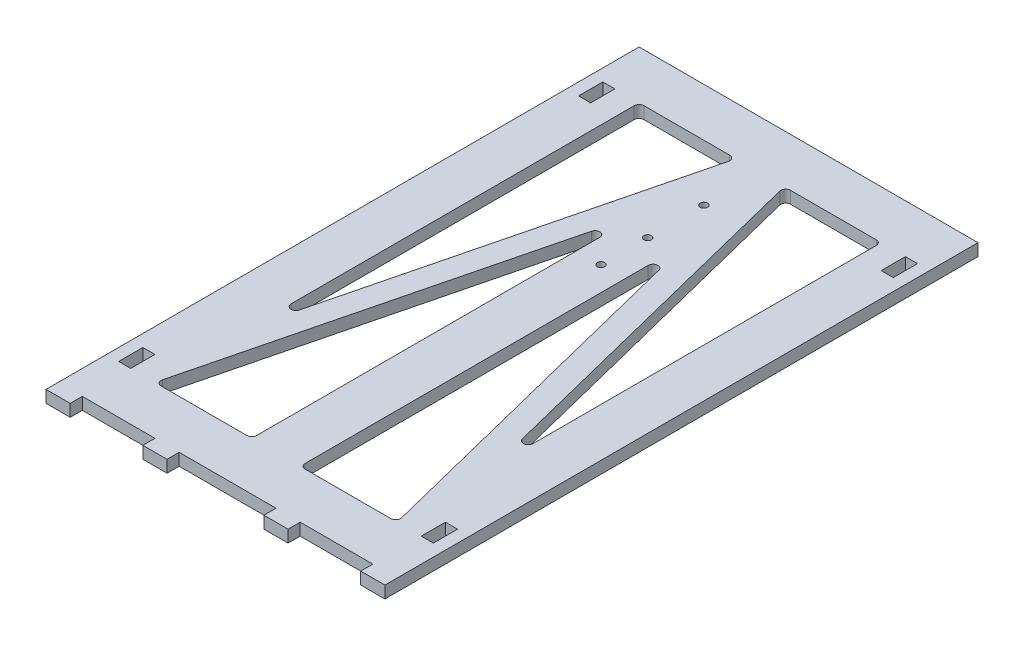
from build123d import *

# Parameters (mm, degrees)
SKETCH1_W         = 6.35
SKETCH1_H         = 12.7
SKETCH1_R         = 1.93499994
FRONT_PANEL_DEPTH = 6.35
FILLET1_R         = 2.54


with BuildPart() as part:
    # Sketch1 → Front Panel (new body)
    with BuildSketch(Plane(origin=(0, 0, 0), x_dir=(1, 0, 0), z_dir=(0, 1, 0))):
        Polygon((0, 304.8), (0, -6.35), (12.7, -6.35), (12.7, 0), (50.8, 0), (50.8, -6.35), (63.5, -6.35), (63.5, 0), (114.3, 0), (114.3, -6.35), (127, -6.35), (127, 0), (165.1, 0), (165.1, -6.35), (177.8, -6.35), (177.8, 304.8), align=None)
        with Locations((9.525, 31.75)):
            Rectangle(SKETCH1_W, SKETCH1_H, mode=Mode.SUBTRACT)
        Polygon((25.4, 25.4), (76.2, 228.6), (76.2, 25.4), align=None, mode=Mode.SUBTRACT)
        with Locations((168.275, 31.75)):
            Rectangle(SKETCH1_W, SKETCH1_H, mode=Mode.SUBTRACT)
        Polygon((101.6, 25.4), (101.6, 228.6), (152.4, 25.4), align=None, mode=Mode.SUBTRACT)
        Polygon((25.4, 279.4), (76.2, 279.4), (25.4, 76.2), align=None, mode=Mode.SUBTRACT)
        with Locations((9.525, 273.05)):
            Rectangle(SKETCH1_W, SKETCH1_H, mode=Mode.SUBTRACT)
        Polygon((152.4, 76.2), (101.6, 279.4), (152.4, 279.4), align=None, mode=Mode.SUBTRACT)
        with Locations((88.9, 195.900000122)):
            Circle(SKETCH1_R, mode=Mode.SUBTRACT)
        with Locations((88.9, 220.400000144)):
            Circle(SKETCH1_R, mode=Mode.SUBTRACT)
        with Locations((88.9, 249.900000072)):
            Circle(SKETCH1_R, mode=Mode.SUBTRACT)
        with Locations((168.275, 273.05)):
            Rectangle(SKETCH1_W, SKETCH1_H, mode=Mode.SUBTRACT)
    extrude(amount=FRONT_PANEL_DEPTH)

    # Fillet1
    fillet1_edges = [part.edges().sort_by_distance(p)[0] for p in [
        (25.4, 3.175, -279.4),
        (76.2, 3.175, -279.4),
        (25.4, 3.175, -76.2),
        (25.4, 3.175, -25.4),
        (76.2, 3.175, -25.4),
        (76.2, 3.175, -228.6),
        (101.6, 3.175, -228.6),
        (101.6, 3.175, -25.4),
        (152.4, 3.175, -25.4),
        (152.4, 3.175, -76.2),
        (152.4, 3.175, -279.4),
        (101.6, 3.175, -279.4),
    ]]
    fillet(fillet1_edges, radius=FILLET1_R)


solid = part.part
